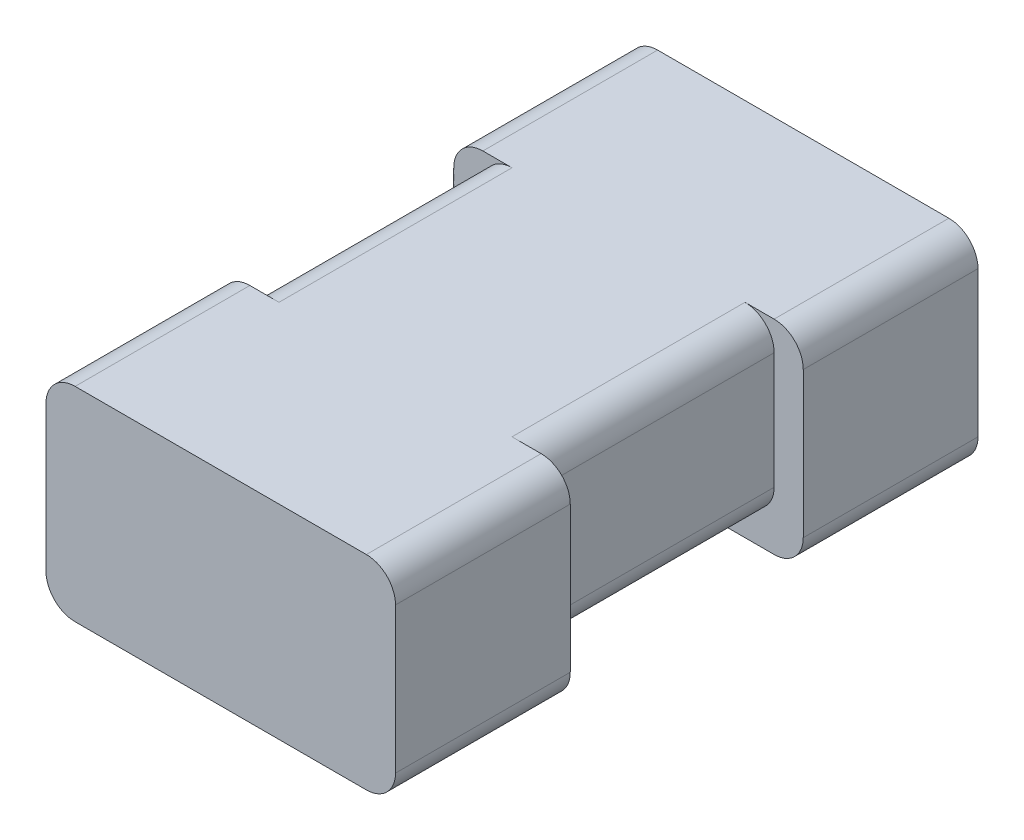
from build123d import *

# Parameters (mm, degrees)
SKETCH2_W           = 0.5
SKETCH2_H           = 0.3
BOSS_EXTRUDE1_DEPTH = 0.4
SKETCH3_W           = 0.6
SKETCH3_H           = 0.35
BOSS_EXTRUDE2_DEPTH = 0.3
SKETCH4_W           = 0.6
SKETCH4_H           = 0.35
BOSS_EXTRUDE4_DEPTH = 0.3
FILLET2_R           = 0.05


with BuildPart() as part:
    # Sketch2 → Boss-Extrude1 (new body)
    with BuildSketch(Plane.XY):
        with Locations((0.25, -0.15)):
            Rectangle(SKETCH2_W, SKETCH2_H)
    extrude(amount=BOSS_EXTRUDE1_DEPTH)

    # Sketch3 → Boss-Extrude2 (add)
    with BuildSketch(Plane.XY.offset(0.4)):
        with Locations((0.25, -0.175)):
            Rectangle(SKETCH3_W, SKETCH3_H)
    extrude(amount=BOSS_EXTRUDE2_DEPTH)

    # Sketch4 → Boss-Extrude4 (add)
    with BuildSketch(Plane(origin=(0, 0, 0), x_dir=(-1, 0, 0), z_dir=(0, 0, -1))):
        with Locations((-0.25, -0.175)):
            Rectangle(SKETCH4_W, SKETCH4_H)
    extrude(amount=BOSS_EXTRUDE4_DEPTH)

    # Fillet2
    fillet2_edges = [part.edges().sort_by_distance(p)[0] for p in [
        (0.55, -0.35, 0.55),
        (-0.05, -0.35, 0.55),
        (-0.05, -0.35, -0.15),
        (0.55, -0.35, -0.15),
        (0.5, -0.3, 0.2),
        (0, -0.3, 0.2),
        (0.55, 0, 0.55),
        (-0.05, 0, 0.55),
        (0, 0, 0.2),
        (0.5, 0, 0.2),
        (0.55, 0, -0.15),
        (-0.05, 0, -0.15),
    ]]
    fillet(fillet2_edges, radius=FILLET2_R - 0.0001)  # a hair under: the kernel refuses the full size


solid = part.part
